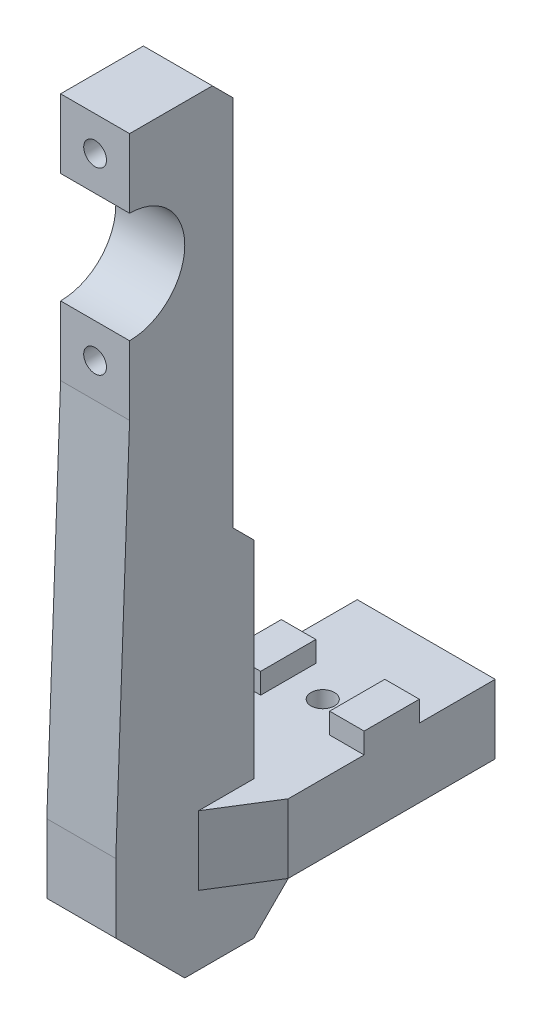
from build123d import *

# Parameters (mm, degrees)
EXTRUDE_1_DEPTH = 10
EXTRUDE_2_DEPTH = 5
SKETCH_4_W      = 5
SKETCH_4_H      = 8
EXTRUDE_3_DEPTH = 3
CHAMFER_1_SIZE  = 3


# Read off the part's stored shape, not the designer's step: 高级异型孔3, 高级异型孔4
with BuildPart() as part:
    # 草图1 → 凸台-拉伸1 (new body)
    with BuildSketch(Plane(origin=(0, 0, 0), x_dir=(1, 0, 0), z_dir=(0, 1, 0))):
        Polygon((0, 0), (5, -8), (5, 0), (15, 0), (15, -8), (20, 0), (20, 30), (0, 30), align=None)
    extrude(amount=-EXTRUDE_1_DEPTH)

    # 草图2 → 凸台-拉伸2 (add, symmetric)
    with BuildSketch(Plane(origin=(10, 0, 0), x_dir=(0, 0, -1), z_dir=(1, 0, 0))):
        with BuildLine():
            Line((0, 30), (-3, 33))
            Line((-3, 33), (-3, 90))
            Line((-3, 90), (-18, 90))
            Line((-18, 90), (-18, 80))
            ThreePointArc((-18, 80), (-10, 72), (-18, 64))
            Line((-18, 64), (-18, 54))
            Line((-18, 54), (-20, 0))
            Line((-20, 0), (-20, -10))
            Line((-20, -10), (-10, -20))
            Line((-10, -20), (0, -20))
            Line((0, -20), (10, -10))
            Line((10, -10), (0, -10))
            Line((0, -10), (0, 30))
        make_face()
    extrude(amount=EXTRUDE_2_DEPTH, both=True)

    # 草图4 → 凸台-拉伸3 (add)
    with BuildSketch(Plane(origin=(0, 0, 0), x_dir=(1, 0, 0), z_dir=(0, 1, 0))):
        with Locations((2.5, 15)):
            Rectangle(SKETCH_4_W, SKETCH_4_H)
        with Locations((17.5, 15)):
            Rectangle(SKETCH_4_W, SKETCH_4_H)
    extrude(amount=EXTRUDE_3_DEPTH)

    # 高级异型孔3 outline → 高级异型孔3 (revolve, cut)
    with BuildSketch(Plane(origin=(10, 0, -15), x_dir=(1, 0, 0), z_dir=(0, 0, 1))):
        Polygon((0, -10), (3.15, -10), (1.7, -8.55), (1.7, 0), (0, 0), align=None)
    revolve(axis=Axis((10, 0, -15), (0, 1, 0)), mode=Mode.SUBTRACT)

    # 高级异型孔4 outline → 高级异型孔4 (revolve, cut)
    with BuildSketch(Plane(origin=(10, 59, 0), x_dir=(1, 0, 0), z_dir=(0, -1, 0))):
        Polygon((0, 7.008579979), (1.65, 8), (1.65, 18), (0, 18), align=None)
    revolve(axis=Axis((10, 59, 0), (0, 0, 1)), mode=Mode.SUBTRACT)

    # Other 4 2 outline → Other 4 2 (revolve, cut)
    with BuildSketch(Plane(origin=(10, 85, 0), x_dir=(1, 0, 0), z_dir=(0, -1, 0))):
        Polygon((0, 7.008579979), (1.65, 8), (1.65, 18), (0, 18), align=None)
    revolve(axis=Axis((10, 85, 0), (0, 0, 1)), mode=Mode.SUBTRACT)

    # 倒角1
    chamfer_1_edges = [part.edges().sort_by_distance(p)[0] for p in [
        (10, 90, 3),
    ]]
    chamfer(chamfer_1_edges, length=CHAMFER_1_SIZE)


solid = part.part
